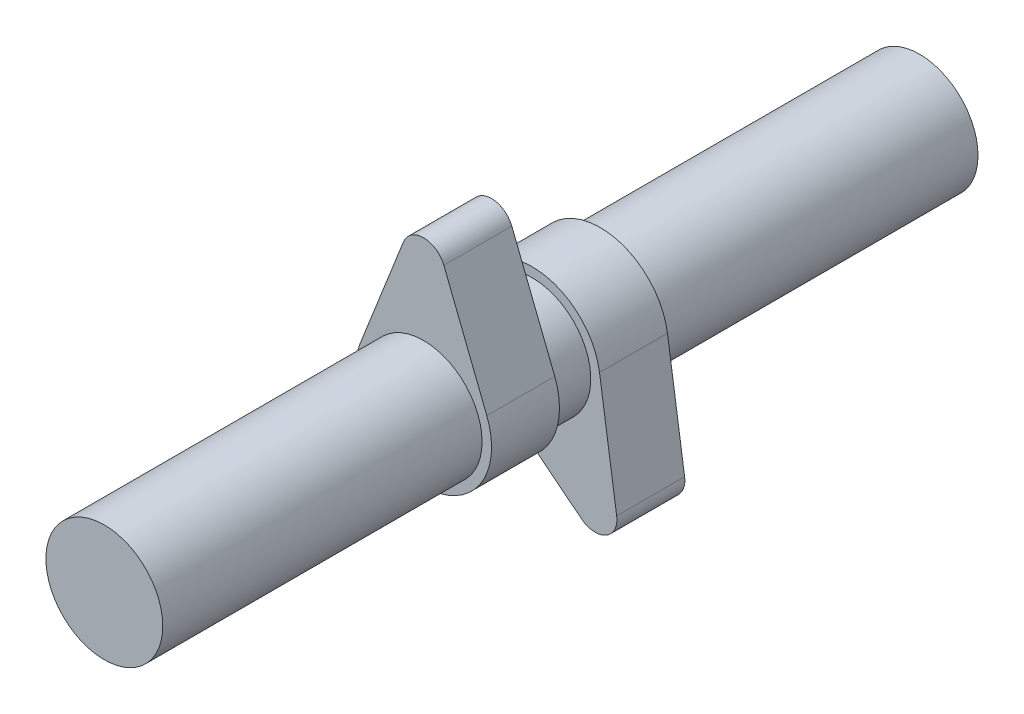
from build123d import *

# Parameters (mm, degrees)
SKETCH2_R           = 21.5
BOSS_EXTRUDE1_DEPTH = 150
BOSS_EXTRUDE2_START = -130
SKETCH3_R           = 21.5
BOSS_EXTRUDE2_DEPTH = 12.5
BOSS_EXTRUDE3_START = -170
BOSS_EXTRUDE3_DEPTH = 12.5


with BuildPart() as part:
    # Sketch2 → Boss-Extrude1 (new, symmetric)
    with BuildSketch(Plane.XY):
        Circle(SKETCH2_R)
    extrude(amount=BOSS_EXTRUDE1_DEPTH, both=True)

    # Sketch3 → Boss-Extrude2 (add, symmetric)
    with BuildSketch(Plane.XY.offset(150).offset(BOSS_EXTRUDE2_START)):
        with BuildLine():
            Line((-7.439944635, 49.189425731), (-23.249826983, 9.189425731))
            ThreePointArc((-23.249826983, 9.189425731), (0, -25), (23.249826983, 9.189425731))
            Line((23.249826983, 9.189425731), (7.439944635, 49.189425731))
            ThreePointArc((7.439944635, 49.189425731), (0, 54.248809497), (-7.439944635, 49.189425731))
        make_face()
        Circle(SKETCH3_R, mode=Mode.SUBTRACT)
    extrude(amount=BOSS_EXTRUDE2_DEPTH, both=True)

    # Sketch4 → Boss-Extrude3 (add, symmetric)
    with BuildSketch(Plane.XY.offset(150).offset(BOSS_EXTRUDE3_START)):
        with BuildLine():
            Line((24.729653666, 3.666637363), (31.037893922, -38.879319963))
            ThreePointArc((31.037893922, -38.879319963), (27.124404748, -46.980847149), (18.151531809, -46.319264598))
            Line((18.151531809, -46.319264598), (-15.540227936, -19.58318962))
            ThreePointArc((-15.540227936, -19.58318962), (-12.5, 21.650635095), (24.729653666, 3.666637363))
        make_face()
    extrude(amount=BOSS_EXTRUDE3_DEPTH, both=True)


solid = part.part
